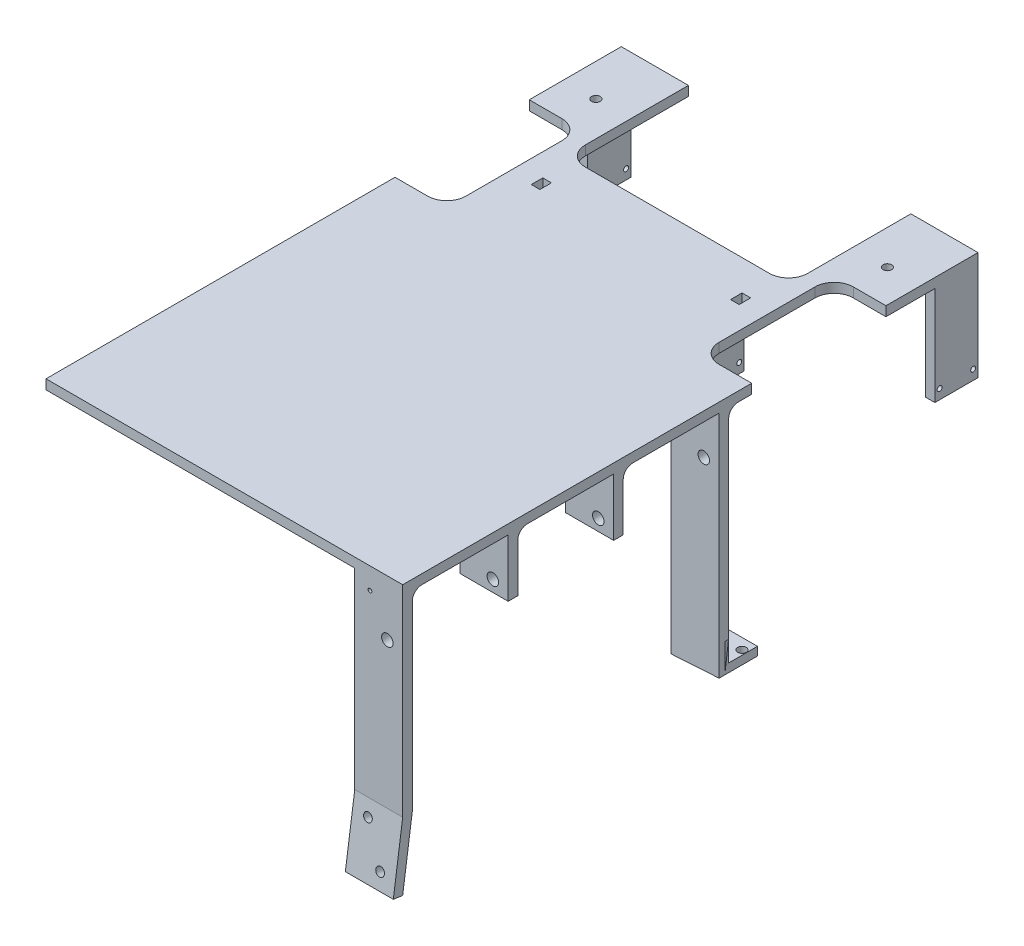
from build123d import *

# Parameters (mm, degrees)
BOSS_EXTRUDE1_DEPTH      = 5
SKETCH2_W                = 5
SKETCH2_H                = 22.5
BOSS_EXTRUDE2_DEPTH      = 38
SKETCH5_W                = 25
SKETCH5_H                = 5
BOSS_EXTRUDE3_DEPTH      = 30
FILLET3_R                = 5
SKETCH6_R                = 3
CUT_EXTRUDE4_DEPTH       = 172
SKETCH7_W                = 5
SKETCH7_H                = 22.5
BOSS_EXTRUDE4_DEPTH      = 51.5
SKETCH3_R                = 1.3
CUT_EXTRUDE2_DEPTH       = 357.71872673
SKETCH9_W                = 116
SKETCH9_H                = 63.779574991
CUT_EXTRUDE6_DEPTH       = 10
SKETCH10_W               = 25
SKETCH10_H               = 5
BOSS_EXTRUDE5_DEPTH      = 70
BOSS_EXTRUDE6_DEPTH      = 25
SKETCH12_W               = 25
SKETCH12_H               = 5
BOSS_EXTRUDE7_DEPTH      = 19.72
BOSS_EXTRUDE8_DEPTH      = 15
BOSS_EXTRUDE8_DEPTH_BACK = 5
CUT_EXTRUDE7_DEPTH       = 15
SKETCH15_R               = 2.25
CUT_EXTRUDE8_DEPTH       = 20
SKETCH16_W               = 6
SKETCH16_H               = 3
BOSS_EXTRUDE9_DEPTH      = 12.4
SKETCH17_R               = 1
CUT_EXTRUDE9_DEPTH       = 282.347152812
FILLET4_R                = 5
SKETCH18_R               = 2.25
CUT_EXTRUDE10_DEPTH      = 377.877481106
SKETCH19_W               = 4.5
SKETCH19_H               = 6
CUT_EXTRUDE12_DEPTH      = 382.938956729
SKETCH20_R               = 2.25
CUT_EXTRUDE13_DEPTH      = 382.938956729
FILLET6_R                = 10
SKETCH21_W               = 27
SKETCH21_H               = 70
CUT_EXTRUDE14_DEPTH      = 382.938956729
FILLET7_R                = 10


with BuildPart() as part:
    # Sketch1 → Boss-Extrude1 (new body)
    with BuildSketch(Plane(origin=(0, 0, 0), x_dir=(1, 0, 0), z_dir=(0, 1, 0))):
        Polygon((0, 0), (0, -300), (186, -300), (186, 0), (176, 0), (151, 0), (151, -56.115865257), (35, -56.115865257), (35, 0), (10, 0), align=None)
    extrude(amount=BOSS_EXTRUDE1_DEPTH)

    # Sketch2 → Boss-Extrude2 (add)
    with BuildSketch(Plane.XZ):
        with Locations((53, 82.75)):
            Rectangle(SKETCH2_W, SKETCH2_H)
        with Locations((133, 82.75)):
            Rectangle(SKETCH2_W, SKETCH2_H)
    extrude(amount=BOSS_EXTRUDE2_DEPTH)

    # Sketch5 → Boss-Extrude3 (add)
    with BuildSketch(Plane.XZ):
        with Locations((173.5, 297.5)):
            Rectangle(SKETCH5_W, SKETCH5_H)
        with Locations((173.5, 242.5)):
            Rectangle(SKETCH5_W, SKETCH5_H)
        with Locations((173.5, 187.5)):
            Rectangle(SKETCH5_W, SKETCH5_H)
        with Locations((173.5, 132.5)):
            Rectangle(SKETCH5_W, SKETCH5_H)
    extrude(amount=BOSS_EXTRUDE3_DEPTH)

    # Fillet3
    fillet3_edges = [part.edges().sort_by_distance(p)[0] for p in [
        (173.5, 0, 130),
        (173.5, 0, 185),
        (173.5, 0, 240),
        (173.5, 0, 295),
    ]]
    fillet(fillet3_edges, radius=FILLET3_R)

    # Sketch6 → Cut-Extrude4 (cut)
    with BuildSketch(Plane.XY.offset(300)):
        with Locations((178, -24)):
            Circle(SKETCH6_R)
    extrude(amount=-CUT_EXTRUDE4_DEPTH, mode=Mode.SUBTRACT)

    # Sketch7 → Boss-Extrude4 (add)
    with BuildSketch(Plane.XZ):
        with Locations((2.5, 11.25)):
            Rectangle(SKETCH7_W, SKETCH7_H)
        with Locations((183.5, 11.25)):
            Rectangle(SKETCH7_W, SKETCH7_H)
    extrude(amount=BOSS_EXTRUDE4_DEPTH)

    # Sketch3 → Cut-Extrude2 (cut, through all)
    with BuildSketch(Plane(origin=(186, 0, 0), x_dir=(0, 0, -1), z_dir=(1, 0, 0))):
        with Locations((-74, -32.9)):
            Circle(SKETCH3_R)
        with Locations((-91.5, -32.9)):
            Circle(SKETCH3_R)
        with Locations((-20, -46.4)):
            Circle(SKETCH3_R)
        with Locations((-2.5, -46.4)):
            Circle(SKETCH3_R)
    extrude(amount=-CUT_EXTRUDE2_DEPTH, mode=Mode.SUBTRACT)

    # Sketch9 → Cut-Extrude6 (cut)
    with BuildSketch(Plane.XZ):
        with Locations((93, 31.889787496)):
            Rectangle(SKETCH9_W, SKETCH9_H)
    extrude(amount=-CUT_EXTRUDE6_DEPTH, mode=Mode.SUBTRACT)

    # Sketch10 → Boss-Extrude5 (add)
    with BuildSketch(Plane.XZ.offset(30)):
        with Locations((173.5, 297.5)):
            Rectangle(SKETCH10_W, SKETCH10_H)
        with Locations((173.5, 132.5)):
            Rectangle(SKETCH10_W, SKETCH10_H)
    extrude(amount=BOSS_EXTRUDE5_DEPTH)

    # Sketch11 → Boss-Extrude6 (add)
    with BuildSketch(Plane(origin=(186, 0, 0), x_dir=(0, 0, -1), z_dir=(1, 0, 0))):
        Polygon((-300, -100), (-304.901863346, -134.643852153), (-300, -135.337431613), (-295, -100), align=None)
    extrude(amount=-BOSS_EXTRUDE6_DEPTH)

    # Sketch12 → Boss-Extrude7 (add)
    with BuildSketch(Plane.XZ.offset(100)):
        with Locations((173.5, 132.5)):
            Rectangle(SKETCH12_W, SKETCH12_H)
    extrude(amount=BOSS_EXTRUDE7_DEPTH)

    # Sketch13 → Boss-Extrude8 (add, two sides: drawn at the far end of the back side and taken through both)
    with BuildSketch(Plane(origin=(0, 0, 130), x_dir=(-1, 0, 0), z_dir=(0, 0, -1)).offset(-BOSS_EXTRUDE8_DEPTH_BACK)):
        Polygon((-186, -115.314128401), (-186, -119.72), (-161, -121.261907364), (-161, -115.314128401), align=None)
    extrude(amount=BOSS_EXTRUDE8_DEPTH + BOSS_EXTRUDE8_DEPTH_BACK)

    # Sketch14 → Cut-Extrude7 (cut)
    with BuildSketch(Plane(origin=(8.06076068, -130.69463294, 0), x_dir=(0.9981034265069344, 0.061559320944247826, 0), z_dir=(0.061559320944247826, -0.9981034265069344, 0))):
        Polygon((186.357631366, 115), (178.277355427, 132.037436989), (198.015187573, 130.430954629), (197.515117956, 111.366582762), (186.357631366, 109.607523038), align=None)
    extrude(amount=-CUT_EXTRUDE7_DEPTH, mode=Mode.SUBTRACT)

    # Sketch15 → Cut-Extrude8 (cut)
    with BuildSketch(Plane(origin=(0, 39.65203451, 280.240211564), x_dir=(1, 0, 0), z_dir=(0, 0.14009757598944012, 0.9901377021414158))):
        with Locations((178, -168.031966348)):
            Circle(SKETCH15_R)
        with Locations((169, -149.043043011)):
            Circle(SKETCH15_R)
    extrude(amount=-CUT_EXTRUDE8_DEPTH, mode=Mode.SUBTRACT)

    # Sketch16 → Boss-Extrude9 (add)
    with BuildSketch(Plane.XZ):
        with Locations((169, 273.5)):
            Rectangle(SKETCH16_W, SKETCH16_H)
        with Locations((140.4, 275.597024766)):
            Rectangle(SKETCH16_W, SKETCH16_H)
        with Locations((169, 218.5)):
            Rectangle(SKETCH16_W, SKETCH16_H)
        with Locations((169, 163.5)):
            Rectangle(SKETCH16_W, SKETCH16_H)
        with Locations((140.4, 220.230204368)):
            Rectangle(SKETCH16_W, SKETCH16_H)
        with Locations((140.4, 166.026024879)):
            Rectangle(SKETCH16_W, SKETCH16_H)
    extrude(amount=BOSS_EXTRUDE9_DEPTH)

    # Sketch17 → Cut-Extrude9 (cut, through all)
    with BuildSketch(Plane(origin=(0, 0, 162), x_dir=(-1, 0, 0), z_dir=(0, 0, -1))):
        with Locations((-168.95, -6.2)):
            Circle(SKETCH17_R)
        with Locations((-140.45, -6.2)):
            Circle(SKETCH17_R)
    extrude(amount=-CUT_EXTRUDE9_DEPTH, mode=Mode.SUBTRACT)

    # Fillet4
    fillet4_edges = [part.edges().sort_by_distance(p)[0] for p in [
        (140.4, 0, 277.097024766),
        (169, 0, 275),
        (140.4, 0, 221.730204368),
        (169, 0, 220),
        (140.4, 0, 167.526024879),
        (169, 0, 165),
    ]]
    fillet(fillet4_edges, radius=FILLET4_R)

    # Sketch18 → Cut-Extrude10 (cut, through all)
    with BuildSketch(Plane(origin=(0, -115.314128401, 0), x_dir=(1, 0, 0), z_dir=(0, 1, 0))):
        with Locations((183.531775176, -120.647103439)):
            Circle(SKETCH18_R)
    extrude(amount=-CUT_EXTRUDE10_DEPTH, mode=Mode.SUBTRACT)

    # Sketch19 → Cut-Extrude12 (cut, through all)
    with BuildSketch(Plane.XZ):
        with Locations((41.05, 82.75)):
            Rectangle(SKETCH19_W, SKETCH19_H)
        with Locations((144.95, 82.75)):
            Rectangle(SKETCH19_W, SKETCH19_H)
    extrude(amount=-CUT_EXTRUDE12_DEPTH, mode=Mode.SUBTRACT)

    # Sketch20 → Cut-Extrude13 (cut, through all)
    with BuildSketch(Plane.XZ):
        with Locations((169, 30.25)):
            Circle(SKETCH20_R)
        with Locations((169, 55.25)):
            Circle(SKETCH20_R)
        with Locations((17, 55.25)):
            Circle(SKETCH20_R)
        with Locations((17, 30.25)):
            Circle(SKETCH20_R)
    extrude(amount=-CUT_EXTRUDE13_DEPTH, mode=Mode.SUBTRACT)

    # Fillet6
    fillet6_edges = [part.edges().sort_by_distance(p)[0] for p in [
        (151, 2.5, 63.779574991),
        (35, 2.5, 63.779574991),
    ]]
    fillet(fillet6_edges, radius=FILLET6_R)

    # Sketch21 → Cut-Extrude14 (cut, through all)
    with BuildSketch(Plane.XZ):
        with Locations((13.5, 83)):
            Rectangle(SKETCH21_W, SKETCH21_H)
        with Locations((172.5, 83)):
            Rectangle(SKETCH21_W, SKETCH21_H)
    extrude(amount=-CUT_EXTRUDE14_DEPTH, mode=Mode.SUBTRACT)

    # Fillet7
    fillet7_edges = [part.edges().sort_by_distance(p)[0] for p in [
        (27, 2.5, 118),
        (27, 2.5, 48),
        (159, 2.5, 48),
        (159, 2.5, 118),
    ]]
    fillet(fillet7_edges, radius=FILLET7_R)


solid = part.part
